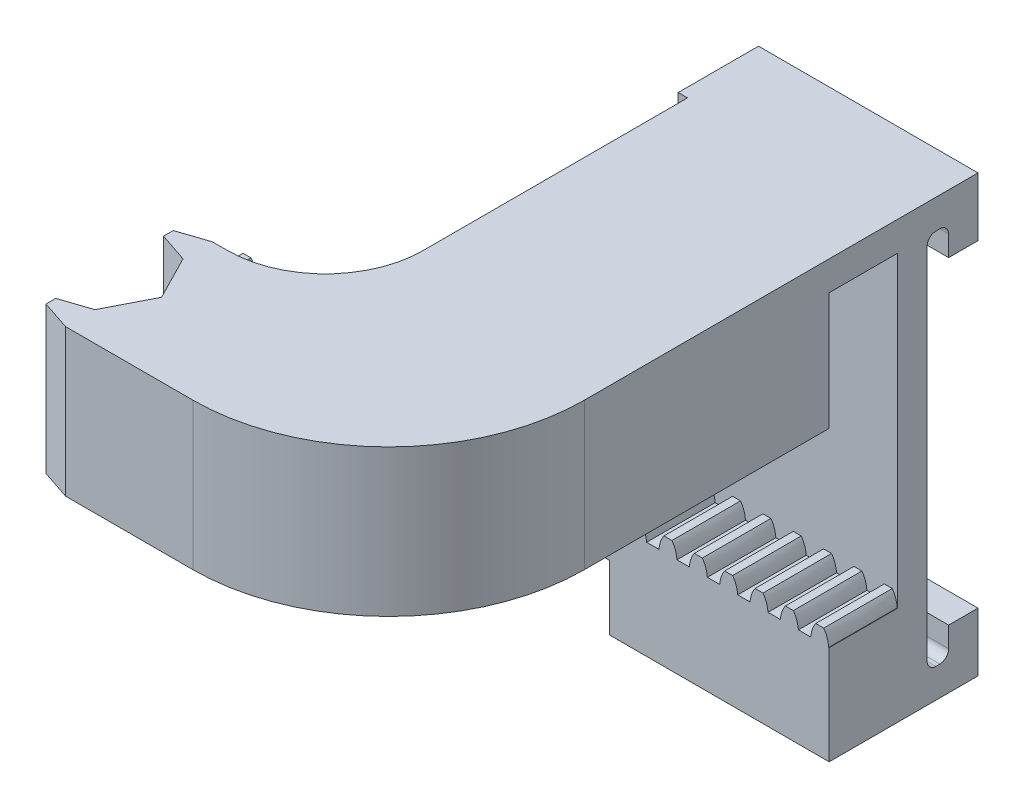
from build123d import *

# Parameters (mm, degrees)
AUFSATZ_LINEAR_AUSTRAGEN1_DEPTH = 3
SKIZZE2_W                       = 22.420234048
SKIZZE2_H                       = 44.5
AUFSATZ_LINEAR_AUSTRAGEN2_DEPTH = 3
AUFSATZ_LINEAR_AUSTRAGEN3_DEPTH = 22.420234048
AUFSATZ_LINEAR_AUSTRAGEN4_DEPTH = 7
AUFSATZ_LINEAR_AUSTRAGEN5_DEPTH = 7
LINEARES_START                  = -28.831514324
LINEARES_MUSTER1_DEPTH          = 7
SKIZZE6_W                       = 22.420234048
SKIZZE6_H                       = 6.6
AUFSATZ_LINEAR_AUSTRAGEN6_DEPTH = 7
VERRUNDUNG1_R                   = 20
VERRUNDUNG2_R                   = 10
SCHNITT_LINEAR_START            = -42.983045
SKIZZE7_W                       = 3.5
SKIZZE7_H                       = 4.952310452
SCHNITT_LINEAR_AUSTRAGEN1_DEPTH = 42.983045
AUFSATZ_LINEAR_AUSTRAGEN7_DEPTH = 12
SCHNITT_LINEAR_AUSTRAGEN2_DEPTH = 22.95


# Read off the part's stored shape, not the designer's step: Lineares Muster1
with BuildPart() as part:
    # Skizze1 → Aufsatz-Linear austragen1 (new body)
    with BuildSketch(Plane(origin=(0, 0, 0), x_dir=(1, 0, 0), z_dir=(0, 1, 0))):
        Polygon((30.693232997, 31.831514324), (30.693232997, -23.168485676), (-2.306767003, -23.168485676), (-5.306767324, -22.168485676), (-5.306767324, -21.168485676), (-2.306767003, -20.168485676), (-5.306767324, -19.168485676), (-5.306767324, -18.168485676), (-2.306767003, -17.168485676), (-5.306767324, -16.168485676), (-5.306767324, -15.168485676), (-2.306767003, -14.168485676), (-5.306767324, -13.168485676), (-5.306767324, -12.168485676), (-2.306767003, -11.168485676), (-5.306767324, -10.168485676), (-5.306767324, -9.168485676), (-2.306767003, -8.168485676), (9.224420896, -8.168485676), (9.224420896, 31.831514324), align=None)
    extrude(amount=AUFSATZ_LINEAR_AUSTRAGEN1_DEPTH)

    # Skizze2 → Aufsatz-Linear austragen2 (add)
    with BuildSketch(Plane(origin=(0, 0, -31.831514324), x_dir=(-1, 0, 0), z_dir=(0, 0, -1))):
        with Locations((-19.483115973, -19.25)):
            Rectangle(SKIZZE2_W, SKIZZE2_H)
    extrude(amount=-AUFSATZ_LINEAR_AUSTRAGEN2_DEPTH)

    # Skizze3 → Aufsatz-Linear austragen3 (add)
    with BuildSketch(Plane(origin=(30.693232997, 0, 0), x_dir=(0, 0, -1), z_dir=(1, 0, 0))):
        with BuildLine():
            Line((37.031514324, 3), (37.031514324, 0))
            Line((37.031514324, 0), (37.031514324, -3))
            Line((37.031514324, -3), (34.031514324, -3))
            Line((34.031514324, -3), (34.031514324, -0.9))
            ThreePointArc((34.031514324, -0.9), (33.767910427, -0.263603897), (33.131514324, 0))
            Line((33.131514324, 0), (32.731513687, 0))
            ThreePointArc((32.731513687, 0), (32.095117584, -0.263603897), (31.831513687, -0.9))
            Line((31.831513687, -0.9), (31.831513687, -3))
            Line((31.831513687, -3), (28.831514324, -3))
            Line((28.831514324, -3), (28.831514324, 3))
            Line((28.831514324, 3), (37.031514324, 3))
        make_face()
        with BuildLine():
            Line((28.831514324, -41.5), (37.031514324, -41.5))
            Line((37.031514324, -41.5), (37.031514324, -38.5))
            Line((37.031514324, -38.5), (37.031514324, -35.5))
            Line((37.031514324, -35.5), (34.031514324, -35.5))
            Line((34.031514324, -35.5), (34.031514324, -37.6))
            ThreePointArc((34.031514324, -37.6), (33.767910427, -38.236396103), (33.131514324, -38.5))
            Line((33.131514324, -38.5), (32.731514324, -38.5))
            ThreePointArc((32.731514324, -38.5), (32.095118221, -38.236396103), (31.831514324, -37.6))
            Line((31.831514324, -37.6), (31.831514324, -35.5))
            Line((31.831514324, -35.5), (28.831514324, -35.5))
            Line((28.831514324, -35.5), (28.831514324, -41.5))
        make_face()
    extrude(amount=-AUFSATZ_LINEAR_AUSTRAGEN3_DEPTH)

    # Skizze4 → Aufsatz-Linear austragen4 (add)
    with BuildSketch(Plane.XY.offset(-28.831514324)):
        Polygon((9.220579556, -31.4), (-34.710045469, -31.4), (-34.710045469, -34.9), (9.220579556, -34.9), (11.703115994, -34.9), (30.693232997, -34.9), (30.693232997, -31.4), (11.703115994, -31.4), align=None)
    extrude(amount=AUFSATZ_LINEAR_AUSTRAGEN4_DEPTH)

    # Skizze5 → Aufsatz-Linear austragen5 (add)
    with BuildSketch(Plane.XY.offset(-21.831514324)):
        with BuildLine():
            Line((7.105206323, -31.4), (8.947130309, -31.4))
            add(Edge.make_bspline(
                [(8.433908462, -29.947689548), (8.851074878, -30.508538383), (8.947130309, -31.4)],
                knots=[0, 0, 0, 1, 1, 1], degree=2))
            Line((8.433908462, -29.947689548), (7.61842817, -29.947689548))
            add(Edge.make_bspline(
                [(7.61842817, -29.947689548), (7.201261753, -30.508538383), (7.105206323, -31.4)],
                knots=[0, 0, 0, 1, 1, 1], degree=2))
        make_face()
    extrude(amount=-AUFSATZ_LINEAR_AUSTRAGEN5_DEPTH)

    # Lineares Muster1 outline → Lineares Muster1 (add)
    with BuildSketch(Plane.XY.offset(LINEARES_START)):
        with BuildLine():
            add(Edge.make_bspline(
                [(29.31842817, -29.947689548), (28.901261753, -30.508538383), (28.805206323, -31.4)],
                knots=[0, 0, 0, 1, 1, 1], degree=2))
            Line((28.805206323, -31.4), (30.647130308, -31.4))
            add(Edge.make_bspline(
                [(30.133908462, -29.947689548), (30.551074878, -30.508538383), (30.647130308, -31.4)],
                knots=[0, 0, 0, 1, 1, 1], degree=2))
            Line((30.133908462, -29.947689548), (29.31842817, -29.947689548))
        make_face()
        with BuildLine():
            add(Edge.make_bspline(
                [(26.21842817, -29.947689548), (25.801261753, -30.508538383), (25.705206323, -31.4)],
                knots=[0, 0, 0, 1, 1, 1], degree=2))
            Line((25.705206323, -31.4), (27.547130309, -31.4))
            add(Edge.make_bspline(
                [(27.033908462, -29.947689548), (27.451074878, -30.508538383), (27.547130309, -31.4)],
                knots=[0, 0, 0, 1, 1, 1], degree=2))
            Line((27.033908462, -29.947689548), (26.21842817, -29.947689548))
        make_face()
        with BuildLine():
            add(Edge.make_bspline(
                [(23.11842817, -29.947689548), (22.701261753, -30.508538383), (22.605206323, -31.4)],
                knots=[0, 0, 0, 1, 1, 1], degree=2))
            Line((22.605206323, -31.4), (24.447130309, -31.4))
            add(Edge.make_bspline(
                [(23.933908462, -29.947689548), (24.351074878, -30.508538383), (24.447130309, -31.4)],
                knots=[0, 0, 0, 1, 1, 1], degree=2))
            Line((23.933908462, -29.947689548), (23.11842817, -29.947689548))
        make_face()
        with BuildLine():
            add(Edge.make_bspline(
                [(20.01842817, -29.947689548), (19.601261753, -30.508538383), (19.505206323, -31.4)],
                knots=[0, 0, 0, 1, 1, 1], degree=2))
            Line((19.505206323, -31.4), (21.347130308, -31.4))
            add(Edge.make_bspline(
                [(20.833908462, -29.947689548), (21.251074878, -30.508538383), (21.347130308, -31.4)],
                knots=[0, 0, 0, 1, 1, 1], degree=2))
            Line((20.833908462, -29.947689548), (20.01842817, -29.947689548))
        make_face()
        with BuildLine():
            add(Edge.make_bspline(
                [(16.91842817, -29.947689548), (16.501261753, -30.508538383), (16.405206323, -31.4)],
                knots=[0, 0, 0, 1, 1, 1], degree=2))
            Line((16.405206323, -31.4), (18.247130309, -31.4))
            add(Edge.make_bspline(
                [(17.733908462, -29.947689548), (18.151074878, -30.508538383), (18.247130309, -31.4)],
                knots=[0, 0, 0, 1, 1, 1], degree=2))
            Line((17.733908462, -29.947689548), (16.91842817, -29.947689548))
        make_face()
        with BuildLine():
            add(Edge.make_bspline(
                [(13.81842817, -29.947689548), (13.401261753, -30.508538383), (13.305206323, -31.4)],
                knots=[0, 0, 0, 1, 1, 1], degree=2))
            Line((13.305206323, -31.4), (15.147130308, -31.4))
            add(Edge.make_bspline(
                [(14.633908462, -29.947689548), (15.051074878, -30.508538383), (15.147130308, -31.4)],
                knots=[0, 0, 0, 1, 1, 1], degree=2))
            Line((14.633908462, -29.947689548), (13.81842817, -29.947689548))
        make_face()
        with BuildLine():
            add(Edge.make_bspline(
                [(11.533908462, -29.947689548), (11.951074878, -30.508538383), (12.047130308, -31.4)],
                knots=[0, 0, 0, 1, 1, 1], degree=2))
            Line((11.533908462, -29.947689548), (10.71842817, -29.947689548))
            add(Edge.make_bspline(
                [(10.71842817, -29.947689548), (10.301261753, -30.508538383), (10.205206323, -31.4)],
                knots=[0, 0, 0, 1, 1, 1], degree=2))
            Line((10.205206323, -31.4), (12.047130308, -31.4))
        make_face()
        with BuildLine():
            Line((-33.194793677, -31.4), (-31.352869692, -31.4))
            add(Edge.make_bspline(
                [(-31.866091538, -29.947689548), (-31.448925122, -30.508538383), (-31.352869692, -31.4)],
                knots=[0, 0, 0, 1, 1, 1], degree=2))
            Line((-31.866091538, -29.947689548), (-32.68157183, -29.947689548))
            add(Edge.make_bspline(
                [(-32.68157183, -29.947689548), (-33.098738247, -30.508538383), (-33.194793677, -31.4)],
                knots=[0, 0, 0, 1, 1, 1], degree=2))
        make_face()
        with BuildLine():
            Line((-30.094793677, -31.4), (-28.252869691, -31.4))
            add(Edge.make_bspline(
                [(-28.766091538, -29.947689548), (-28.348925122, -30.508538383), (-28.252869691, -31.4)],
                knots=[0, 0, 0, 1, 1, 1], degree=2))
            Line((-28.766091538, -29.947689548), (-29.58157183, -29.947689548))
            add(Edge.make_bspline(
                [(-29.58157183, -29.947689548), (-29.998738247, -30.508538383), (-30.094793677, -31.4)],
                knots=[0, 0, 0, 1, 1, 1], degree=2))
        make_face()
        with BuildLine():
            Line((-26.994793677, -31.4), (-25.152869692, -31.4))
            add(Edge.make_bspline(
                [(-25.666091538, -29.947689548), (-25.248925122, -30.508538383), (-25.152869692, -31.4)],
                knots=[0, 0, 0, 1, 1, 1], degree=2))
            Line((-25.666091538, -29.947689548), (-26.48157183, -29.947689548))
            add(Edge.make_bspline(
                [(-26.48157183, -29.947689548), (-26.898738247, -30.508538383), (-26.994793677, -31.4)],
                knots=[0, 0, 0, 1, 1, 1], degree=2))
        make_face()
        with BuildLine():
            Line((-23.894793677, -31.4), (-22.052869691, -31.4))
            add(Edge.make_bspline(
                [(-22.566091538, -29.947689548), (-22.148925122, -30.508538383), (-22.052869691, -31.4)],
                knots=[0, 0, 0, 1, 1, 1], degree=2))
            Line((-22.566091538, -29.947689548), (-23.38157183, -29.947689548))
            add(Edge.make_bspline(
                [(-23.38157183, -29.947689548), (-23.798738247, -30.508538383), (-23.894793677, -31.4)],
                knots=[0, 0, 0, 1, 1, 1], degree=2))
        make_face()
        with BuildLine():
            Line((-20.794793677, -31.4), (-18.952869691, -31.4))
            add(Edge.make_bspline(
                [(-19.466091538, -29.947689548), (-19.048925122, -30.508538383), (-18.952869691, -31.4)],
                knots=[0, 0, 0, 1, 1, 1], degree=2))
            Line((-19.466091538, -29.947689548), (-20.28157183, -29.947689548))
            add(Edge.make_bspline(
                [(-20.28157183, -29.947689548), (-20.698738247, -30.508538383), (-20.794793677, -31.4)],
                knots=[0, 0, 0, 1, 1, 1], degree=2))
        make_face()
        with BuildLine():
            Line((-17.694793677, -31.4), (-15.852869692, -31.4))
            add(Edge.make_bspline(
                [(-16.366091538, -29.947689548), (-15.948925122, -30.508538383), (-15.852869692, -31.4)],
                knots=[0, 0, 0, 1, 1, 1], degree=2))
            Line((-16.366091538, -29.947689548), (-17.18157183, -29.947689548))
            add(Edge.make_bspline(
                [(-17.18157183, -29.947689548), (-17.598738247, -30.508538383), (-17.694793677, -31.4)],
                knots=[0, 0, 0, 1, 1, 1], degree=2))
        make_face()
        with BuildLine():
            Line((-14.594793677, -31.4), (-12.752869692, -31.4))
            add(Edge.make_bspline(
                [(-13.266091538, -29.947689548), (-12.848925122, -30.508538383), (-12.752869692, -31.4)],
                knots=[0, 0, 0, 1, 1, 1], degree=2))
            Line((-13.266091538, -29.947689548), (-14.08157183, -29.947689548))
            add(Edge.make_bspline(
                [(-14.08157183, -29.947689548), (-14.498738247, -30.508538383), (-14.594793677, -31.4)],
                knots=[0, 0, 0, 1, 1, 1], degree=2))
        make_face()
        with BuildLine():
            Line((-11.494793677, -31.4), (-9.652869691, -31.4))
            add(Edge.make_bspline(
                [(-10.166091538, -29.947689548), (-9.748925122, -30.508538383), (-9.652869691, -31.4)],
                knots=[0, 0, 0, 1, 1, 1], degree=2))
            Line((-10.166091538, -29.947689548), (-10.98157183, -29.947689548))
            add(Edge.make_bspline(
                [(-10.98157183, -29.947689548), (-11.398738247, -30.508538383), (-11.494793677, -31.4)],
                knots=[0, 0, 0, 1, 1, 1], degree=2))
        make_face()
        with BuildLine():
            Line((-8.394793677, -31.4), (-6.552869691, -31.4))
            add(Edge.make_bspline(
                [(-7.066091538, -29.947689548), (-6.648925122, -30.508538383), (-6.552869691, -31.4)],
                knots=[0, 0, 0, 1, 1, 1], degree=2))
            Line((-7.066091538, -29.947689548), (-7.88157183, -29.947689548))
            add(Edge.make_bspline(
                [(-7.88157183, -29.947689548), (-8.298738247, -30.508538383), (-8.394793677, -31.4)],
                knots=[0, 0, 0, 1, 1, 1], degree=2))
        make_face()
        with BuildLine():
            Line((-5.294793677, -31.4), (-3.452869691, -31.4))
            add(Edge.make_bspline(
                [(-3.966091538, -29.947689548), (-3.548925122, -30.508538383), (-3.452869691, -31.4)],
                knots=[0, 0, 0, 1, 1, 1], degree=2))
            Line((-3.966091538, -29.947689548), (-4.78157183, -29.947689548))
            add(Edge.make_bspline(
                [(-4.78157183, -29.947689548), (-5.198738247, -30.508538383), (-5.294793677, -31.4)],
                knots=[0, 0, 0, 1, 1, 1], degree=2))
        make_face()
        with BuildLine():
            Line((-2.194793677, -31.4), (-0.352869691, -31.4))
            add(Edge.make_bspline(
                [(-0.866091538, -29.947689548), (-0.448925122, -30.508538383), (-0.352869691, -31.4)],
                knots=[0, 0, 0, 1, 1, 1], degree=2))
            Line((-0.866091538, -29.947689548), (-1.68157183, -29.947689548))
            add(Edge.make_bspline(
                [(-1.68157183, -29.947689548), (-2.098738247, -30.508538383), (-2.194793677, -31.4)],
                knots=[0, 0, 0, 1, 1, 1], degree=2))
        make_face()
        with BuildLine():
            Line((0.905206323, -31.4), (2.747130309, -31.4))
            add(Edge.make_bspline(
                [(2.233908462, -29.947689548), (2.651074878, -30.508538383), (2.747130309, -31.4)],
                knots=[0, 0, 0, 1, 1, 1], degree=2))
            Line((2.233908462, -29.947689548), (1.41842817, -29.947689548))
            add(Edge.make_bspline(
                [(1.41842817, -29.947689548), (1.001261753, -30.508538383), (0.905206323, -31.4)],
                knots=[0, 0, 0, 1, 1, 1], degree=2))
        make_face()
        with BuildLine():
            add(Edge.make_bspline(
                [(5.333908462, -29.947689548), (5.751074878, -30.508538383), (5.847130309, -31.4)],
                knots=[0, 0, 0, 1, 1, 1], degree=2))
            Line((5.333908462, -29.947689548), (4.51842817, -29.947689548))
            add(Edge.make_bspline(
                [(4.51842817, -29.947689548), (4.101261753, -30.508538383), (4.005206323, -31.4)],
                knots=[0, 0, 0, 1, 1, 1], degree=2))
            Line((4.005206323, -31.4), (5.847130309, -31.4))
        make_face()
    extrude(amount=LINEARES_MUSTER1_DEPTH)

    # Skizze6 → Aufsatz-Linear austragen6 (add)
    with BuildSketch(Plane.XY.offset(-21.831514324)):
        with Locations((19.483115973, -38.2)):
            Rectangle(SKIZZE6_W, SKIZZE6_H)
    extrude(amount=-AUFSATZ_LINEAR_AUSTRAGEN6_DEPTH)

    # Verrundung1
    verrundung1_edges = [part.edges().sort_by_distance(p)[0] for p in [
        (30.693232997, 1.5, 23.168485676),
    ]]
    fillet(verrundung1_edges, radius=VERRUNDUNG1_R)

    # Verrundung2
    verrundung2_edges = [part.edges().sort_by_distance(p)[0] for p in [
        (9.224420896, 1.5, 8.168485676),
    ]]
    fillet(verrundung2_edges, radius=VERRUNDUNG2_R)

    # Skizze7 → Schnitt-Linear austragen1 (cut)
    with BuildSketch(Plane.ZY.offset(34.710045469).offset(SCHNITT_LINEAR_START)):
        with Locations((-27.081514324, -32.423844774)):
            Rectangle(SKIZZE7_W, SKIZZE7_H)
    extrude(amount=SCHNITT_LINEAR_AUSTRAGEN1_DEPTH, mode=Mode.SUBTRACT)

    # Skizze9 → Aufsatz-Linear austragen7 (add)
    with BuildSketch(Plane.XZ):
        with BuildLine():
            ThreePointArc((-0.775579104, 8.168485676), (6.295488708, 5.239553487), (9.224420896, -1.831514324))
            Line((9.224420896, -1.831514324), (9.224420896, -21.831514324))
            Line((9.224420896, -21.831514324), (30.693232997, -21.831514324))
            Line((30.693232997, -21.831514324), (30.693232997, 3.168485676))
            ThreePointArc((30.693232997, 3.168485676), (24.835368621, 17.310621299), (10.693232997, 23.168485676))
            Line((10.693232997, 23.168485676), (-2.306767003, 23.168485676))
            Line((-2.306767003, 23.168485676), (-5.306767324, 22.168485676))
            Line((-5.306767324, 22.168485676), (-5.306767324, 21.168485676))
            Line((-5.306767324, 21.168485676), (-2.306767003, 20.168485676))
            Line((-2.306767003, 20.168485676), (-5.306767324, 19.168485676))
            Line((-5.306767324, 19.168485676), (-5.306767324, 18.168485676))
            Line((-5.306767324, 18.168485676), (-2.306767003, 17.168485676))
            Line((-2.306767003, 17.168485676), (-5.306767324, 16.168485676))
            Line((-5.306767324, 16.168485676), (-5.306767324, 15.168485676))
            Line((-5.306767324, 15.168485676), (-2.306767003, 14.168485676))
            Line((-2.306767003, 14.168485676), (-5.306767324, 13.168485676))
            Line((-5.306767324, 13.168485676), (-5.306767324, 12.168485676))
            Line((-5.306767324, 12.168485676), (-2.306767003, 11.168485676))
            Line((-2.306767003, 11.168485676), (-5.306767324, 10.168485676))
            Line((-5.306767324, 10.168485676), (-5.306767324, 9.168485676))
            Line((-5.306767324, 9.168485676), (-2.306767003, 8.168485676))
            Line((-2.306767003, 8.168485676), (-0.775579104, 8.168485676))
        make_face()
    extrude(amount=AUFSATZ_LINEAR_AUSTRAGEN7_DEPTH)

    # Skizze10 → Schnitt-Linear austragen2 (cut)
    with BuildSketch(Plane.XZ.offset(12)):
        Polygon((-2.306767003, 20.168485676), (0, 15.668485676), (-2.306767003, 11.168485676), (-7.77118591, 11.168485676), (-7.77118591, 20.203930075), align=None)
    extrude(amount=-SCHNITT_LINEAR_AUSTRAGEN2_DEPTH, mode=Mode.SUBTRACT)


solid = part.part
